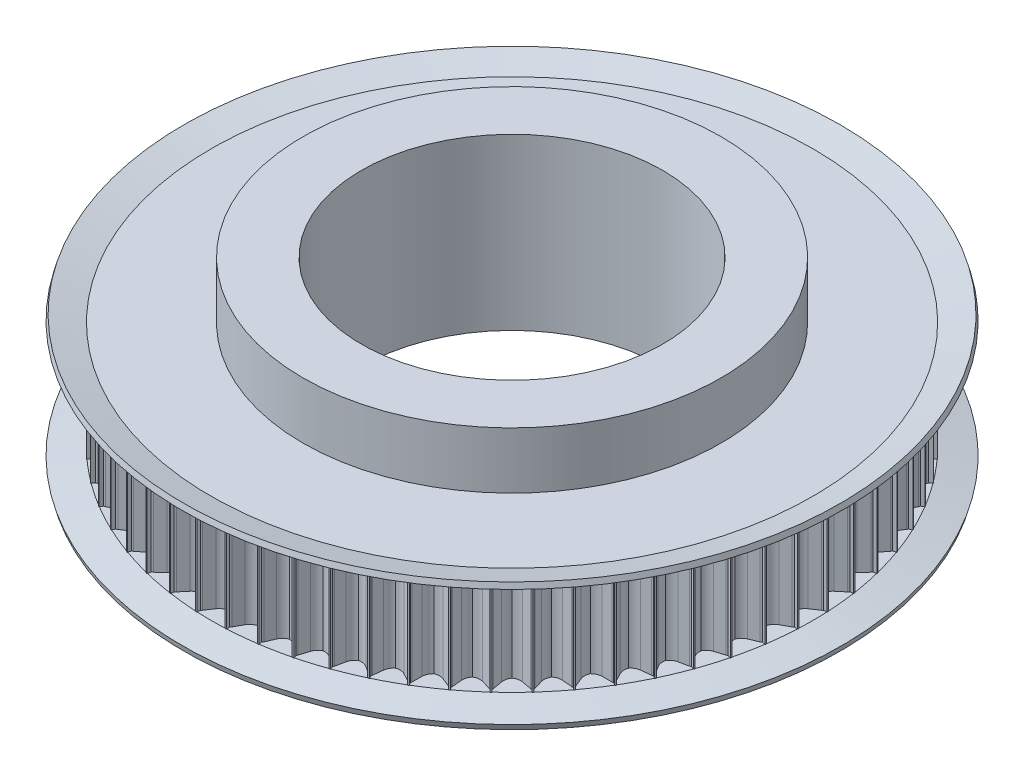
from build123d import *

# Parameters (mm, degrees)
SKETCH1_R           = 80
SKETCH1_R_2         = 40
BOSS_EXTRUDE1_DEPTH = 27
CUT_EXTRUDE2_DEPTH  = 27


with BuildPart() as part:
    # Sketch1 → Boss-Extrude1 (new body)
    with BuildSketch(Plane(origin=(0, 0, 0), x_dir=(1, 0, 0), z_dir=(0, 1, 0))):
        Circle(SKETCH1_R)
        Circle(SKETCH1_R_2, mode=Mode.SUBTRACT)
    extrude(amount=BOSS_EXTRUDE1_DEPTH)

    # Sketch2 → Cut-Extrude2 (cut)
    with BuildSketch(Plane(origin=(0, 27, 0), x_dir=(1, 0, 0), z_dir=(0, 1, 0))):
        with BuildLine():
            Line((76.55820386, 2.007597536), (78.68913052, 3.465599987))
            ThreePointArc((78.68913052, 3.465599987), (78.854600633, 3.596830616), (79, 3.75))
            Line((79, 3.75), (81.356619288, 3.75))
            Line((81.356619288, 3.75), (81.356619288, -3.75))
            Line((81.356619288, -3.75), (79, -3.75))
            ThreePointArc((79, -3.75), (78.854600633, -3.596830616), (78.68913052, -3.465599987))
            Line((78.68913052, -3.465599987), (76.55820386, -2.007597536))
            ThreePointArc((76.55820386, -2.007597536), (75.716480212, -1.134748785), (75.289035669, 0))
            ThreePointArc((75.289035669, 0), (75.716480212, 1.134748785), (76.55820386, 2.007597536))
        make_face()
        with BuildLine():
            Line((76.386334153, -5.506085806), (78.649909049, -4.263971372))
            ThreePointArc((78.649909049, -4.263971372), (78.827445229, -4.149591563), (78.987157683, -4.011411361))
            Line((78.987157683, -4.011411361), (81.332429205, -4.242400444))
            Line((81.332429205, -4.242400444), (80.597300653, -11.706285895))
            Line((80.597300653, -11.706285895), (78.252029131, -11.475296811))
            ThreePointArc((78.252029131, -11.475296811), (78.122343127, -11.308613349), (77.970532648, -11.161795725))
            Line((77.970532648, -11.161795725), (75.992776214, -9.501946616))
            ThreePointArc((75.992776214, -9.501946616), (75.240659834, -8.550797526), (74.926498384, -7.379615974))
            ThreePointArc((74.926498384, -7.379615974), (75.463109496, -6.292228207), (76.386334153, -5.506085806))
        make_face()
        with BuildLine():
            Line((75.47882229, -12.966742532), (77.853245959, -11.952478357))
            ThreePointArc((77.853245959, -11.952478357), (78.041138436, -11.856050906), (78.213625859, -11.734190638))
            Line((78.213625859, -11.734190638), (80.524963369, -12.193944254))
            Line((80.524963369, -12.193944254), (79.061785953, -19.549833857))
            Line((79.061785953, -19.549833857), (76.750448444, -19.090080241))
            ThreePointArc((76.750448444, -19.090080241), (76.63772475, -18.911487954), (76.501035924, -18.750497268))
            Line((76.501035924, -18.750497268), (74.695496591, -16.904786756))
            ThreePointArc((74.695496591, -16.904786756), (74.04023077, -15.884497412), (73.84237796, -14.688162213))
            ThreePointArc((73.84237796, -14.688162213), (74.482987782, -13.658607601), (75.47882229, -12.966742532))
        make_face()
        with BuildLine():
            Line((73.844408108, -20.302522439), (76.306813552, -19.525876441))
            ThreePointArc((76.306813552, -19.525876441), (76.503252818, -19.448329998), (76.686854063, -19.343963244))
            Line((76.686854063, -19.343963244), (78.941998115, -20.028053714))
            Line((78.941998115, -20.028053714), (76.764863036, -27.205106232))
            Line((76.764863036, -27.205106232), (74.509718983, -26.521015762))
            ThreePointArc((74.509718983, -26.521015762), (74.41504319, -26.332234592), (74.294792404, -26.158621272))
            Line((74.294792404, -26.158621272), (72.678858502, -24.144824559))
            ThreePointArc((72.678858502, -24.144824559), (72.12675381, -23.065220904), (72.04711507, -21.85525342))
            ThreePointArc((72.04711507, -21.85525342), (72.78555418, -20.893447138), (73.844408108, -20.302522439))
        make_face()
        with BuildLine():
            Line((71.498831908, -27.442777956), (74.025504817, -26.911229661))
            ThreePointArc((74.025504817, -26.911229661), (74.228599055, -26.853311041), (74.42154594, -26.76744291))
            Line((74.42154594, -26.76744291), (76.598778266, -27.669282068))
            Line((76.598778266, -27.669282068), (73.728652523, -34.598378562))
            Line((73.728652523, -34.598378562), (71.551420197, -33.696539404))
            ThreePointArc((71.551420197, -33.696539404), (71.475704084, -33.499387416), (71.37304942, -33.314823453))
            Line((71.37304942, -33.314823453), (69.962283276, -31.152334502))
            ThreePointArc((69.962283276, -31.152334502), (69.518656782, -30.023813711), (69.557999078, -28.811866589))
            ThreePointArc((69.557999078, -28.811866589), (70.387155902, -27.927071357), (71.498831908, -27.442777956))
        make_face()
        with BuildLine():
            Line((68.464682872, -34.31874452), (71.031290004, -34.037413028))
            ThreePointArc((71.031290004, -34.037413028), (71.239083305, -33.999680018), (71.439517647, -33.933137468))
            Line((71.439517647, -33.933137468), (73.517870309, -35.04404011))
            Line((73.517870309, -35.04404011), (69.982394782, -41.658449593))
            Line((69.982394782, -41.658449593), (67.90404212, -40.547546951))
            ThreePointArc((67.90404212, -40.547546951), (67.848014875, -40.343922826), (67.763944953, -40.150185673))
            Line((67.763944953, -40.150185673), (66.571933017, -37.859830434))
            ThreePointArc((66.571933017, -37.859830434), (66.241057087, -36.693260779), (66.399001529, -35.491005733))
            ThreePointArc((66.399001529, -35.491005733), (67.310890835, -34.691742613), (68.464682872, -34.31874452))
        make_face()
        with BuildLine():
            Line((64.771181513, -40.864202813), (67.353005038, -40.835797501))
            ThreePointArc((67.353005038, -40.835797501), (67.56349624, -40.818613491), (67.769487746, -40.772037362))
            Line((67.769487746, -40.772037362), (69.728945071, -42.081304889))
            Line((69.728945071, -42.081304889), (65.562168324, -48.317326982))
            Line((65.562168324, -48.317326982), (63.602710998, -47.008059455))
            ThreePointArc((63.602710998, -47.008059455), (63.566912194, -46.799924206), (63.502236653, -46.598879657))
            Line((63.502236653, -46.598879657), (62.540458651, -44.202715503))
            ThreePointArc((62.540458651, -44.202715503), (62.3255198, -43.009331687), (62.600545299, -41.828347091))
            ThreePointArc((62.600545299, -41.828347091), (63.586385094, -41.122313423), (64.771181513, -40.864202813))
        make_face()
        with BuildLine():
            Line((60.453898269, -47.016116495), (63.026073816, -47.240910921))
            ThreePointArc((63.026073816, -47.240910921), (63.237235772, -47.244441402), (63.446800631, -47.218280249))
            Line((63.446800631, -47.218280249), (65.268491975, -48.713303698))
            Line((65.268491975, -48.713303698), (60.510542344, -54.510882099))
            Line((60.510542344, -54.510882099), (58.688851, -53.015858649))
            ThreePointArc((58.688851, -53.015858649), (58.673625399, -52.805216732), (58.6289671, -52.598800956))
            Line((58.6289671, -52.598800956), (57.906685481, -50.119904258))
            ThreePointArc((57.906685481, -50.119904258), (57.809753688, -48.91119922), (58.199211596, -47.7628586))
            ThreePointArc((58.199211596, -47.7628586), (59.249507704, -47.156853875), (60.453898269, -47.016116495))
        make_face()
        with BuildLine():
            Line((55.554410937, -52.715239273), (58.092167048, -53.191068544))
            ThreePointArc((58.092167048, -53.191068544), (58.301966155, -53.215279517), (58.513086143, -53.209785284))
            Line((58.513086143, -53.209785284), (60.179467622, -54.876166763))
            Line((60.179467622, -54.876166763), (54.876166763, -60.179467622))
            Line((54.876166763, -60.179467622), (53.209785284, -58.513086143))
            ThreePointArc((53.209785284, -58.513086143), (53.215279517, -58.301966155), (53.191068544, -58.092167048))
            Line((53.191068544, -58.092167048), (52.715239273, -55.554410937))
            ThreePointArc((52.715239273, -55.554410937), (52.737248045, -54.342025167), (53.237387671, -53.237387671))
            ThreePointArc((53.237387671, -53.237387671), (54.342025167, -52.737248045), (55.554410937, -52.715239273))
        make_face()
        with BuildLine():
            Line((50.119904258, -57.906685481), (52.598800956, -58.6289671))
            ThreePointArc((52.598800956, -58.6289671), (52.805216732, -58.673625399), (53.015858649, -58.688851))
            Line((53.015858649, -58.688851), (54.510882099, -60.510542344))
            Line((54.510882099, -60.510542344), (48.713303698, -65.268491975))
            Line((48.713303698, -65.268491975), (47.218280249, -63.446800631))
            ThreePointArc((47.218280249, -63.446800631), (47.244441402, -63.237235772), (47.240910921, -63.026073816))
            Line((47.240910921, -63.026073816), (47.016116495, -60.453898269))
            ThreePointArc((47.016116495, -60.453898269), (47.156853875, -59.249507704), (47.7628586, -58.199211596))
            ThreePointArc((47.7628586, -58.199211596), (48.91119922, -57.809753688), (50.119904258, -57.906685481))
        make_face()
        with BuildLine():
            Line((44.202715503, -62.540458651), (46.598879657, -63.502236653))
            ThreePointArc((46.598879657, -63.502236653), (46.799924206, -63.566912194), (47.008059455, -63.602710998))
            Line((47.008059455, -63.602710998), (48.317326982, -65.562168324))
            Line((48.317326982, -65.562168324), (42.081304889, -69.728945071))
            Line((42.081304889, -69.728945071), (40.772037362, -67.769487746))
            ThreePointArc((40.772037362, -67.769487746), (40.818613491, -67.56349624), (40.835797501, -67.353005038))
            Line((40.835797501, -67.353005038), (40.864202813, -64.771181513))
            ThreePointArc((40.864202813, -64.771181513), (41.122313423, -63.586385094), (41.828347091, -62.600545299))
            ThreePointArc((41.828347091, -62.600545299), (43.009331687, -62.3255198), (44.202715503, -62.540458651))
        make_face()
        with BuildLine():
            Line((37.859830434, -66.571933017), (40.150185673, -67.763944953))
            ThreePointArc((40.150185673, -67.763944953), (40.343922826, -67.848014875), (40.547546951, -67.90404212))
            Line((40.547546951, -67.90404212), (41.658449593, -69.982394782))
            Line((41.658449593, -69.982394782), (35.04404011, -73.517870309))
            Line((35.04404011, -73.517870309), (33.933137468, -71.439517647))
            ThreePointArc((33.933137468, -71.439517647), (33.999680018, -71.239083305), (34.037413028, -71.031290004))
            Line((34.037413028, -71.031290004), (34.31874452, -68.464682872))
            ThreePointArc((34.31874452, -68.464682872), (34.691742613, -67.310890835), (35.491005733, -66.399001529))
            ThreePointArc((35.491005733, -66.399001529), (36.693260779, -66.241057087), (37.859830434, -66.571933017))
        make_face()
        with BuildLine():
            Line((31.152334502, -69.962283276), (33.314823453, -71.37304942))
            ThreePointArc((33.314823453, -71.37304942), (33.499387416, -71.475704084), (33.696539404, -71.551420197))
            Line((33.696539404, -71.551420197), (34.598378562, -73.728652523))
            Line((34.598378562, -73.728652523), (27.669282068, -76.598778266))
            Line((27.669282068, -76.598778266), (26.76744291, -74.42154594))
            ThreePointArc((26.76744291, -74.42154594), (26.853311041, -74.228599055), (26.911229661, -74.025504817))
            Line((26.911229661, -74.025504817), (27.442777956, -71.498831908))
            ThreePointArc((27.442777956, -71.498831908), (27.927071357, -70.387155902), (28.811866589, -69.557999078))
            ThreePointArc((28.811866589, -69.557999078), (30.023813711, -69.518656782), (31.152334502, -69.962283276))
        make_face()
        with BuildLine():
            Line((24.144824559, -72.678858502), (26.158621272, -74.294792404))
            ThreePointArc((26.158621272, -74.294792404), (26.332234592, -74.41504319), (26.521015762, -74.509718983))
            Line((26.521015762, -74.509718983), (27.205106232, -76.764863036))
            Line((27.205106232, -76.764863036), (20.028053714, -78.941998115))
            Line((20.028053714, -78.941998115), (19.343963244, -76.686854063))
            ThreePointArc((19.343963244, -76.686854063), (19.448329998, -76.503252818), (19.525876441, -76.306813552))
            Line((19.525876441, -76.306813552), (20.302522439, -73.844408108))
            ThreePointArc((20.302522439, -73.844408108), (20.893447138, -72.78555418), (21.85525342, -72.04711507))
            ThreePointArc((21.85525342, -72.04711507), (23.065220904, -72.12675381), (24.144824559, -72.678858502))
        make_face()
        with BuildLine():
            Line((16.904786756, -74.695496591), (18.750497268, -76.501035924))
            ThreePointArc((18.750497268, -76.501035924), (18.911487954, -76.63772475), (19.090080241, -76.750448444))
            Line((19.090080241, -76.750448444), (19.549833857, -79.061785953))
            Line((19.549833857, -79.061785953), (12.193944254, -80.524963369))
            Line((12.193944254, -80.524963369), (11.734190638, -78.213625859))
            ThreePointArc((11.734190638, -78.213625859), (11.856050906, -78.041138436), (11.952478357, -77.853245959))
            Line((11.952478357, -77.853245959), (12.966742532, -75.47882229))
            ThreePointArc((12.966742532, -75.47882229), (13.658607601, -74.482987782), (14.688162213, -73.84237796))
            ThreePointArc((14.688162213, -73.84237796), (15.884497412, -74.04023077), (16.904786756, -74.695496591))
        make_face()
        with BuildLine():
            Line((9.501946616, -75.992776214), (11.161795725, -77.970532648))
            ThreePointArc((11.161795725, -77.970532648), (11.308613349, -78.122343127), (11.475296811, -78.252029131))
            Line((11.475296811, -78.252029131), (11.706285895, -80.597300653))
            Line((11.706285895, -80.597300653), (4.242400444, -81.332429205))
            Line((4.242400444, -81.332429205), (4.011411361, -78.987157683))
            ThreePointArc((4.011411361, -78.987157683), (4.149591563, -78.827445229), (4.263971372, -78.649909049))
            Line((4.263971372, -78.649909049), (5.506085806, -76.386334153))
            ThreePointArc((5.506085806, -76.386334153), (6.292228207, -75.463109496), (7.379615974, -74.926498384))
            ThreePointArc((7.379615974, -74.926498384), (8.550797526, -75.240659834), (9.501946616, -75.992776214))
        make_face()
        with BuildLine():
            Line((2.007597536, -76.55820386), (3.465599987, -78.68913052))
            ThreePointArc((3.465599987, -78.68913052), (3.596830616, -78.854600633), (3.75, -79))
            Line((3.75, -79), (3.75, -81.356619288))
            Line((3.75, -81.356619288), (-3.75, -81.356619288))
            Line((-3.75, -81.356619288), (-3.75, -79))
            ThreePointArc((-3.75, -79), (-3.596830616, -78.854600633), (-3.465599987, -78.68913052))
            Line((-3.465599987, -78.68913052), (-2.007597536, -76.55820386))
            ThreePointArc((-2.007597536, -76.55820386), (-1.134748785, -75.716480212), (0, -75.289035669))
            ThreePointArc((0, -75.289035669), (1.134748785, -75.716480212), (2.007597536, -76.55820386))
        make_face()
        with BuildLine():
            Line((-5.506085806, -76.386334153), (-4.263971372, -78.649909049))
            ThreePointArc((-4.263971372, -78.649909049), (-4.149591563, -78.827445229), (-4.011411361, -78.987157683))
            Line((-4.011411361, -78.987157683), (-4.242400444, -81.332429205))
            Line((-4.242400444, -81.332429205), (-11.706285895, -80.597300653))
            Line((-11.706285895, -80.597300653), (-11.475296811, -78.252029131))
            ThreePointArc((-11.475296811, -78.252029131), (-11.308613349, -78.122343127), (-11.161795725, -77.970532648))
            Line((-11.161795725, -77.970532648), (-9.501946616, -75.992776214))
            ThreePointArc((-9.501946616, -75.992776214), (-8.550797526, -75.240659834), (-7.379615974, -74.926498384))
            ThreePointArc((-7.379615974, -74.926498384), (-6.292228207, -75.463109496), (-5.506085806, -76.386334153))
        make_face()
        with BuildLine():
            Line((-12.966742532, -75.47882229), (-11.952478357, -77.853245959))
            ThreePointArc((-11.952478357, -77.853245959), (-11.856050906, -78.041138436), (-11.734190638, -78.213625859))
            Line((-11.734190638, -78.213625859), (-12.193944254, -80.524963369))
            Line((-12.193944254, -80.524963369), (-19.549833857, -79.061785953))
            Line((-19.549833857, -79.061785953), (-19.090080241, -76.750448444))
            ThreePointArc((-19.090080241, -76.750448444), (-18.911487954, -76.63772475), (-18.750497268, -76.501035924))
            Line((-18.750497268, -76.501035924), (-16.904786756, -74.695496591))
            ThreePointArc((-16.904786756, -74.695496591), (-15.884497412, -74.04023077), (-14.688162213, -73.84237796))
            ThreePointArc((-14.688162213, -73.84237796), (-13.658607601, -74.482987782), (-12.966742532, -75.47882229))
        make_face()
        with BuildLine():
            Line((-20.302522439, -73.844408108), (-19.525876441, -76.306813552))
            ThreePointArc((-19.525876441, -76.306813552), (-19.448329998, -76.503252818), (-19.343963244, -76.686854063))
            Line((-19.343963244, -76.686854063), (-20.028053714, -78.941998115))
            Line((-20.028053714, -78.941998115), (-27.205106232, -76.764863036))
            Line((-27.205106232, -76.764863036), (-26.521015762, -74.509718983))
            ThreePointArc((-26.521015762, -74.509718983), (-26.332234592, -74.41504319), (-26.158621272, -74.294792404))
            Line((-26.158621272, -74.294792404), (-24.144824559, -72.678858502))
            ThreePointArc((-24.144824559, -72.678858502), (-23.065220904, -72.12675381), (-21.85525342, -72.04711507))
            ThreePointArc((-21.85525342, -72.04711507), (-20.893447138, -72.78555418), (-20.302522439, -73.844408108))
        make_face()
        with BuildLine():
            Line((-27.442777956, -71.498831908), (-26.911229661, -74.025504817))
            ThreePointArc((-26.911229661, -74.025504817), (-26.853311041, -74.228599055), (-26.76744291, -74.42154594))
            Line((-26.76744291, -74.42154594), (-27.669282068, -76.598778266))
            Line((-27.669282068, -76.598778266), (-34.598378562, -73.728652523))
            Line((-34.598378562, -73.728652523), (-33.696539404, -71.551420197))
            ThreePointArc((-33.696539404, -71.551420197), (-33.499387416, -71.475704084), (-33.314823453, -71.37304942))
            Line((-33.314823453, -71.37304942), (-31.152334502, -69.962283276))
            ThreePointArc((-31.152334502, -69.962283276), (-30.023813711, -69.518656782), (-28.811866589, -69.557999078))
            ThreePointArc((-28.811866589, -69.557999078), (-27.927071357, -70.387155902), (-27.442777956, -71.498831908))
        make_face()
        with BuildLine():
            Line((-34.31874452, -68.464682872), (-34.037413028, -71.031290004))
            ThreePointArc((-34.037413028, -71.031290004), (-33.999680018, -71.239083305), (-33.933137468, -71.439517647))
            Line((-33.933137468, -71.439517647), (-35.04404011, -73.517870309))
            Line((-35.04404011, -73.517870309), (-41.658449593, -69.982394782))
            Line((-41.658449593, -69.982394782), (-40.547546951, -67.90404212))
            ThreePointArc((-40.547546951, -67.90404212), (-40.343922826, -67.848014875), (-40.150185673, -67.763944953))
            Line((-40.150185673, -67.763944953), (-37.859830434, -66.571933017))
            ThreePointArc((-37.859830434, -66.571933017), (-36.693260779, -66.241057087), (-35.491005733, -66.399001529))
            ThreePointArc((-35.491005733, -66.399001529), (-34.691742613, -67.310890835), (-34.31874452, -68.464682872))
        make_face()
        with BuildLine():
            Line((-40.864202813, -64.771181513), (-40.835797501, -67.353005038))
            ThreePointArc((-40.835797501, -67.353005038), (-40.818613491, -67.56349624), (-40.772037362, -67.769487746))
            Line((-40.772037362, -67.769487746), (-42.081304889, -69.728945071))
            Line((-42.081304889, -69.728945071), (-48.317326982, -65.562168324))
            Line((-48.317326982, -65.562168324), (-47.008059455, -63.602710998))
            ThreePointArc((-47.008059455, -63.602710998), (-46.799924206, -63.566912194), (-46.598879657, -63.502236653))
            Line((-46.598879657, -63.502236653), (-44.202715503, -62.540458651))
            ThreePointArc((-44.202715503, -62.540458651), (-43.009331687, -62.3255198), (-41.828347091, -62.600545299))
            ThreePointArc((-41.828347091, -62.600545299), (-41.122313423, -63.586385094), (-40.864202813, -64.771181513))
        make_face()
        with BuildLine():
            Line((-47.016116495, -60.453898269), (-47.240910921, -63.026073816))
            ThreePointArc((-47.240910921, -63.026073816), (-47.244441402, -63.237235772), (-47.218280249, -63.446800631))
            Line((-47.218280249, -63.446800631), (-48.713303698, -65.268491975))
            Line((-48.713303698, -65.268491975), (-54.510882099, -60.510542344))
            Line((-54.510882099, -60.510542344), (-53.015858649, -58.688851))
            ThreePointArc((-53.015858649, -58.688851), (-52.805216732, -58.673625399), (-52.598800956, -58.6289671))
            Line((-52.598800956, -58.6289671), (-50.119904258, -57.906685481))
            ThreePointArc((-50.119904258, -57.906685481), (-48.91119922, -57.809753688), (-47.7628586, -58.199211596))
            ThreePointArc((-47.7628586, -58.199211596), (-47.156853875, -59.249507704), (-47.016116495, -60.453898269))
        make_face()
        with BuildLine():
            Line((-52.715239273, -55.554410937), (-53.191068544, -58.092167048))
            ThreePointArc((-53.191068544, -58.092167048), (-53.215279517, -58.301966155), (-53.209785284, -58.513086143))
            Line((-53.209785284, -58.513086143), (-54.876166763, -60.179467622))
            Line((-54.876166763, -60.179467622), (-60.179467622, -54.876166763))
            Line((-60.179467622, -54.876166763), (-58.513086143, -53.209785284))
            ThreePointArc((-58.513086143, -53.209785284), (-58.301966155, -53.215279517), (-58.092167048, -53.191068544))
            Line((-58.092167048, -53.191068544), (-55.554410937, -52.715239273))
            ThreePointArc((-55.554410937, -52.715239273), (-54.342025167, -52.737248045), (-53.237387671, -53.237387671))
            ThreePointArc((-53.237387671, -53.237387671), (-52.737248045, -54.342025167), (-52.715239273, -55.554410937))
        make_face()
        with BuildLine():
            Line((-57.906685481, -50.119904258), (-58.6289671, -52.598800956))
            ThreePointArc((-58.6289671, -52.598800956), (-58.673625399, -52.805216732), (-58.688851, -53.015858649))
            Line((-58.688851, -53.015858649), (-60.510542344, -54.510882099))
            Line((-60.510542344, -54.510882099), (-65.268491975, -48.713303698))
            Line((-65.268491975, -48.713303698), (-63.446800631, -47.218280249))
            ThreePointArc((-63.446800631, -47.218280249), (-63.237235772, -47.244441402), (-63.026073816, -47.240910921))
            Line((-63.026073816, -47.240910921), (-60.453898269, -47.016116495))
            ThreePointArc((-60.453898269, -47.016116495), (-59.249507704, -47.156853875), (-58.199211596, -47.7628586))
            ThreePointArc((-58.199211596, -47.7628586), (-57.809753688, -48.91119922), (-57.906685481, -50.119904258))
        make_face()
        with BuildLine():
            Line((-62.540458651, -44.202715503), (-63.502236653, -46.598879657))
            ThreePointArc((-63.502236653, -46.598879657), (-63.566912194, -46.799924206), (-63.602710998, -47.008059455))
            Line((-63.602710998, -47.008059455), (-65.562168324, -48.317326982))
            Line((-65.562168324, -48.317326982), (-69.728945071, -42.081304889))
            Line((-69.728945071, -42.081304889), (-67.769487746, -40.772037362))
            ThreePointArc((-67.769487746, -40.772037362), (-67.56349624, -40.818613491), (-67.353005038, -40.835797501))
            Line((-67.353005038, -40.835797501), (-64.771181513, -40.864202813))
            ThreePointArc((-64.771181513, -40.864202813), (-63.586385094, -41.122313423), (-62.600545299, -41.828347091))
            ThreePointArc((-62.600545299, -41.828347091), (-62.3255198, -43.009331687), (-62.540458651, -44.202715503))
        make_face()
        with BuildLine():
            Line((-66.571933017, -37.859830434), (-67.763944953, -40.150185673))
            ThreePointArc((-67.763944953, -40.150185673), (-67.848014875, -40.343922826), (-67.90404212, -40.547546951))
            Line((-67.90404212, -40.547546951), (-69.982394782, -41.658449593))
            Line((-69.982394782, -41.658449593), (-73.517870309, -35.04404011))
            Line((-73.517870309, -35.04404011), (-71.439517647, -33.933137468))
            ThreePointArc((-71.439517647, -33.933137468), (-71.239083305, -33.999680018), (-71.031290004, -34.037413028))
            Line((-71.031290004, -34.037413028), (-68.464682872, -34.31874452))
            ThreePointArc((-68.464682872, -34.31874452), (-67.310890835, -34.691742613), (-66.399001529, -35.491005733))
            ThreePointArc((-66.399001529, -35.491005733), (-66.241057087, -36.693260779), (-66.571933017, -37.859830434))
        make_face()
        with BuildLine():
            Line((-69.962283276, -31.152334502), (-71.37304942, -33.314823453))
            ThreePointArc((-71.37304942, -33.314823453), (-71.475704084, -33.499387416), (-71.551420197, -33.696539404))
            Line((-71.551420197, -33.696539404), (-73.728652523, -34.598378562))
            Line((-73.728652523, -34.598378562), (-76.598778266, -27.669282068))
            Line((-76.598778266, -27.669282068), (-74.42154594, -26.76744291))
            ThreePointArc((-74.42154594, -26.76744291), (-74.228599055, -26.853311041), (-74.025504817, -26.911229661))
            Line((-74.025504817, -26.911229661), (-71.498831908, -27.442777956))
            ThreePointArc((-71.498831908, -27.442777956), (-70.387155902, -27.927071357), (-69.557999078, -28.811866589))
            ThreePointArc((-69.557999078, -28.811866589), (-69.518656782, -30.023813711), (-69.962283276, -31.152334502))
        make_face()
        with BuildLine():
            Line((-72.678858502, -24.144824559), (-74.294792404, -26.158621272))
            ThreePointArc((-74.294792404, -26.158621272), (-74.41504319, -26.332234592), (-74.509718983, -26.521015762))
            Line((-74.509718983, -26.521015762), (-76.764863036, -27.205106232))
            Line((-76.764863036, -27.205106232), (-78.941998115, -20.028053714))
            Line((-78.941998115, -20.028053714), (-76.686854063, -19.343963244))
            ThreePointArc((-76.686854063, -19.343963244), (-76.503252818, -19.448329998), (-76.306813552, -19.525876441))
            Line((-76.306813552, -19.525876441), (-73.844408108, -20.302522439))
            ThreePointArc((-73.844408108, -20.302522439), (-72.78555418, -20.893447138), (-72.04711507, -21.85525342))
            ThreePointArc((-72.04711507, -21.85525342), (-72.12675381, -23.065220904), (-72.678858502, -24.144824559))
        make_face()
        with BuildLine():
            Line((-74.695496591, -16.904786756), (-76.501035924, -18.750497268))
            ThreePointArc((-76.501035924, -18.750497268), (-76.63772475, -18.911487954), (-76.750448444, -19.090080241))
            Line((-76.750448444, -19.090080241), (-79.061785953, -19.549833857))
            Line((-79.061785953, -19.549833857), (-80.524963369, -12.193944254))
            Line((-80.524963369, -12.193944254), (-78.213625859, -11.734190638))
            ThreePointArc((-78.213625859, -11.734190638), (-78.041138436, -11.856050906), (-77.853245959, -11.952478357))
            Line((-77.853245959, -11.952478357), (-75.47882229, -12.966742532))
            ThreePointArc((-75.47882229, -12.966742532), (-74.482987782, -13.658607601), (-73.84237796, -14.688162213))
            ThreePointArc((-73.84237796, -14.688162213), (-74.04023077, -15.884497412), (-74.695496591, -16.904786756))
        make_face()
        with BuildLine():
            Line((-75.992776214, -9.501946616), (-77.970532648, -11.161795725))
            ThreePointArc((-77.970532648, -11.161795725), (-78.122343127, -11.308613349), (-78.252029131, -11.475296811))
            Line((-78.252029131, -11.475296811), (-80.597300653, -11.706285895))
            Line((-80.597300653, -11.706285895), (-81.332429205, -4.242400444))
            Line((-81.332429205, -4.242400444), (-78.987157683, -4.011411361))
            ThreePointArc((-78.987157683, -4.011411361), (-78.827445229, -4.149591563), (-78.649909049, -4.263971372))
            Line((-78.649909049, -4.263971372), (-76.386334153, -5.506085806))
            ThreePointArc((-76.386334153, -5.506085806), (-75.463109496, -6.292228207), (-74.926498384, -7.379615974))
            ThreePointArc((-74.926498384, -7.379615974), (-75.240659834, -8.550797526), (-75.992776214, -9.501946616))
        make_face()
        with BuildLine():
            Line((-76.55820386, -2.007597536), (-78.68913052, -3.465599987))
            ThreePointArc((-78.68913052, -3.465599987), (-78.854600633, -3.596830616), (-79, -3.75))
            Line((-79, -3.75), (-81.356619288, -3.75))
            Line((-81.356619288, -3.75), (-81.356619288, 3.75))
            Line((-81.356619288, 3.75), (-79, 3.75))
            ThreePointArc((-79, 3.75), (-78.854600633, 3.596830616), (-78.68913052, 3.465599987))
            Line((-78.68913052, 3.465599987), (-76.55820386, 2.007597536))
            ThreePointArc((-76.55820386, 2.007597536), (-75.716480212, 1.134748785), (-75.289035669, 0))
            ThreePointArc((-75.289035669, 0), (-75.716480212, -1.134748785), (-76.55820386, -2.007597536))
        make_face()
        with BuildLine():
            Line((-76.386334153, 5.506085806), (-78.649909049, 4.263971372))
            ThreePointArc((-78.649909049, 4.263971372), (-78.827445229, 4.149591563), (-78.987157683, 4.011411361))
            Line((-78.987157683, 4.011411361), (-81.332429205, 4.242400444))
            Line((-81.332429205, 4.242400444), (-80.597300653, 11.706285895))
            Line((-80.597300653, 11.706285895), (-78.252029131, 11.475296811))
            ThreePointArc((-78.252029131, 11.475296811), (-78.122343127, 11.308613349), (-77.970532648, 11.161795725))
            Line((-77.970532648, 11.161795725), (-75.992776214, 9.501946616))
            ThreePointArc((-75.992776214, 9.501946616), (-75.240659834, 8.550797526), (-74.926498384, 7.379615974))
            ThreePointArc((-74.926498384, 7.379615974), (-75.463109496, 6.292228207), (-76.386334153, 5.506085806))
        make_face()
        with BuildLine():
            Line((-75.47882229, 12.966742532), (-77.853245959, 11.952478357))
            ThreePointArc((-77.853245959, 11.952478357), (-78.041138436, 11.856050906), (-78.213625859, 11.734190638))
            Line((-78.213625859, 11.734190638), (-80.524963369, 12.193944254))
            Line((-80.524963369, 12.193944254), (-79.061785953, 19.549833857))
            Line((-79.061785953, 19.549833857), (-76.750448444, 19.090080241))
            ThreePointArc((-76.750448444, 19.090080241), (-76.63772475, 18.911487954), (-76.501035924, 18.750497268))
            Line((-76.501035924, 18.750497268), (-74.695496591, 16.904786756))
            ThreePointArc((-74.695496591, 16.904786756), (-74.04023077, 15.884497412), (-73.84237796, 14.688162213))
            ThreePointArc((-73.84237796, 14.688162213), (-74.482987782, 13.658607601), (-75.47882229, 12.966742532))
        make_face()
        with BuildLine():
            Line((-73.844408108, 20.302522439), (-76.306813552, 19.525876441))
            ThreePointArc((-76.306813552, 19.525876441), (-76.503252818, 19.448329998), (-76.686854063, 19.343963244))
            Line((-76.686854063, 19.343963244), (-78.941998115, 20.028053714))
            Line((-78.941998115, 20.028053714), (-76.764863036, 27.205106232))
            Line((-76.764863036, 27.205106232), (-74.509718983, 26.521015762))
            ThreePointArc((-74.509718983, 26.521015762), (-74.41504319, 26.332234592), (-74.294792404, 26.158621272))
            Line((-74.294792404, 26.158621272), (-72.678858502, 24.144824559))
            ThreePointArc((-72.678858502, 24.144824559), (-72.12675381, 23.065220904), (-72.04711507, 21.85525342))
            ThreePointArc((-72.04711507, 21.85525342), (-72.78555418, 20.893447138), (-73.844408108, 20.302522439))
        make_face()
        with BuildLine():
            Line((-71.498831908, 27.442777956), (-74.025504817, 26.911229661))
            ThreePointArc((-74.025504817, 26.911229661), (-74.228599055, 26.853311041), (-74.42154594, 26.76744291))
            Line((-74.42154594, 26.76744291), (-76.598778266, 27.669282068))
            Line((-76.598778266, 27.669282068), (-73.728652523, 34.598378562))
            Line((-73.728652523, 34.598378562), (-71.551420197, 33.696539404))
            ThreePointArc((-71.551420197, 33.696539404), (-71.475704084, 33.499387416), (-71.37304942, 33.314823453))
            Line((-71.37304942, 33.314823453), (-69.962283276, 31.152334502))
            ThreePointArc((-69.962283276, 31.152334502), (-69.518656782, 30.023813711), (-69.557999078, 28.811866589))
            ThreePointArc((-69.557999078, 28.811866589), (-70.387155902, 27.927071357), (-71.498831908, 27.442777956))
        make_face()
        with BuildLine():
            Line((-68.464682872, 34.31874452), (-71.031290004, 34.037413028))
            ThreePointArc((-71.031290004, 34.037413028), (-71.239083305, 33.999680018), (-71.439517647, 33.933137468))
            Line((-71.439517647, 33.933137468), (-73.517870309, 35.04404011))
            Line((-73.517870309, 35.04404011), (-69.982394782, 41.658449593))
            Line((-69.982394782, 41.658449593), (-67.90404212, 40.547546951))
            ThreePointArc((-67.90404212, 40.547546951), (-67.848014875, 40.343922826), (-67.763944953, 40.150185673))
            Line((-67.763944953, 40.150185673), (-66.571933017, 37.859830434))
            ThreePointArc((-66.571933017, 37.859830434), (-66.241057087, 36.693260779), (-66.399001529, 35.491005733))
            ThreePointArc((-66.399001529, 35.491005733), (-67.310890835, 34.691742613), (-68.464682872, 34.31874452))
        make_face()
        with BuildLine():
            Line((-64.771181513, 40.864202813), (-67.353005038, 40.835797501))
            ThreePointArc((-67.353005038, 40.835797501), (-67.56349624, 40.818613491), (-67.769487746, 40.772037362))
            Line((-67.769487746, 40.772037362), (-69.728945071, 42.081304889))
            Line((-69.728945071, 42.081304889), (-65.562168324, 48.317326982))
            Line((-65.562168324, 48.317326982), (-63.602710998, 47.008059455))
            ThreePointArc((-63.602710998, 47.008059455), (-63.566912194, 46.799924206), (-63.502236653, 46.598879657))
            Line((-63.502236653, 46.598879657), (-62.540458651, 44.202715503))
            ThreePointArc((-62.540458651, 44.202715503), (-62.3255198, 43.009331687), (-62.600545299, 41.828347091))
            ThreePointArc((-62.600545299, 41.828347091), (-63.586385094, 41.122313423), (-64.771181513, 40.864202813))
        make_face()
        with BuildLine():
            Line((-60.453898269, 47.016116495), (-63.026073816, 47.240910921))
            ThreePointArc((-63.026073816, 47.240910921), (-63.237235772, 47.244441402), (-63.446800631, 47.218280249))
            Line((-63.446800631, 47.218280249), (-65.268491975, 48.713303698))
            Line((-65.268491975, 48.713303698), (-60.510542344, 54.510882099))
            Line((-60.510542344, 54.510882099), (-58.688851, 53.015858649))
            ThreePointArc((-58.688851, 53.015858649), (-58.673625399, 52.805216732), (-58.6289671, 52.598800956))
            Line((-58.6289671, 52.598800956), (-57.906685481, 50.119904258))
            ThreePointArc((-57.906685481, 50.119904258), (-57.809753688, 48.91119922), (-58.199211596, 47.7628586))
            ThreePointArc((-58.199211596, 47.7628586), (-59.249507704, 47.156853875), (-60.453898269, 47.016116495))
        make_face()
        with BuildLine():
            Line((-55.554410937, 52.715239273), (-58.092167048, 53.191068544))
            ThreePointArc((-58.092167048, 53.191068544), (-58.301966155, 53.215279517), (-58.513086143, 53.209785284))
            Line((-58.513086143, 53.209785284), (-60.179467622, 54.876166763))
            Line((-60.179467622, 54.876166763), (-54.876166763, 60.179467622))
            Line((-54.876166763, 60.179467622), (-53.209785284, 58.513086143))
            ThreePointArc((-53.209785284, 58.513086143), (-53.215279517, 58.301966155), (-53.191068544, 58.092167048))
            Line((-53.191068544, 58.092167048), (-52.715239273, 55.554410937))
            ThreePointArc((-52.715239273, 55.554410937), (-52.737248045, 54.342025167), (-53.237387671, 53.237387671))
            ThreePointArc((-53.237387671, 53.237387671), (-54.342025167, 52.737248045), (-55.554410937, 52.715239273))
        make_face()
        with BuildLine():
            Line((-50.119904258, 57.906685481), (-52.598800956, 58.6289671))
            ThreePointArc((-52.598800956, 58.6289671), (-52.805216732, 58.673625399), (-53.015858649, 58.688851))
            Line((-53.015858649, 58.688851), (-54.510882099, 60.510542344))
            Line((-54.510882099, 60.510542344), (-48.713303698, 65.268491975))
            Line((-48.713303698, 65.268491975), (-47.218280249, 63.446800631))
            ThreePointArc((-47.218280249, 63.446800631), (-47.244441402, 63.237235772), (-47.240910921, 63.026073816))
            Line((-47.240910921, 63.026073816), (-47.016116495, 60.453898269))
            ThreePointArc((-47.016116495, 60.453898269), (-47.156853875, 59.249507704), (-47.7628586, 58.199211596))
            ThreePointArc((-47.7628586, 58.199211596), (-48.91119922, 57.809753688), (-50.119904258, 57.906685481))
        make_face()
        with BuildLine():
            Line((-44.202715503, 62.540458651), (-46.598879657, 63.502236653))
            ThreePointArc((-46.598879657, 63.502236653), (-46.799924206, 63.566912194), (-47.008059455, 63.602710998))
            Line((-47.008059455, 63.602710998), (-48.317326982, 65.562168324))
            Line((-48.317326982, 65.562168324), (-42.081304889, 69.728945071))
            Line((-42.081304889, 69.728945071), (-40.772037362, 67.769487746))
            ThreePointArc((-40.772037362, 67.769487746), (-40.818613491, 67.56349624), (-40.835797501, 67.353005038))
            Line((-40.835797501, 67.353005038), (-40.864202813, 64.771181513))
            ThreePointArc((-40.864202813, 64.771181513), (-41.122313423, 63.586385094), (-41.828347091, 62.600545299))
            ThreePointArc((-41.828347091, 62.600545299), (-43.009331687, 62.3255198), (-44.202715503, 62.540458651))
        make_face()
        with BuildLine():
            Line((-37.859830434, 66.571933017), (-40.150185673, 67.763944953))
            ThreePointArc((-40.150185673, 67.763944953), (-40.343922826, 67.848014875), (-40.547546951, 67.90404212))
            Line((-40.547546951, 67.90404212), (-41.658449593, 69.982394782))
            Line((-41.658449593, 69.982394782), (-35.04404011, 73.517870309))
            Line((-35.04404011, 73.517870309), (-33.933137468, 71.439517647))
            ThreePointArc((-33.933137468, 71.439517647), (-33.999680018, 71.239083305), (-34.037413028, 71.031290004))
            Line((-34.037413028, 71.031290004), (-34.31874452, 68.464682872))
            ThreePointArc((-34.31874452, 68.464682872), (-34.691742613, 67.310890835), (-35.491005733, 66.399001529))
            ThreePointArc((-35.491005733, 66.399001529), (-36.693260779, 66.241057087), (-37.859830434, 66.571933017))
        make_face()
        with BuildLine():
            Line((-31.152334502, 69.962283276), (-33.314823453, 71.37304942))
            ThreePointArc((-33.314823453, 71.37304942), (-33.499387416, 71.475704084), (-33.696539404, 71.551420197))
            Line((-33.696539404, 71.551420197), (-34.598378562, 73.728652523))
            Line((-34.598378562, 73.728652523), (-27.669282068, 76.598778266))
            Line((-27.669282068, 76.598778266), (-26.76744291, 74.42154594))
            ThreePointArc((-26.76744291, 74.42154594), (-26.853311041, 74.228599055), (-26.911229661, 74.025504817))
            Line((-26.911229661, 74.025504817), (-27.442777956, 71.498831908))
            ThreePointArc((-27.442777956, 71.498831908), (-27.927071357, 70.387155902), (-28.811866589, 69.557999078))
            ThreePointArc((-28.811866589, 69.557999078), (-30.023813711, 69.518656782), (-31.152334502, 69.962283276))
        make_face()
        with BuildLine():
            Line((-24.144824559, 72.678858502), (-26.158621272, 74.294792404))
            ThreePointArc((-26.158621272, 74.294792404), (-26.332234592, 74.41504319), (-26.521015762, 74.509718983))
            Line((-26.521015762, 74.509718983), (-27.205106232, 76.764863036))
            Line((-27.205106232, 76.764863036), (-20.028053714, 78.941998115))
            Line((-20.028053714, 78.941998115), (-19.343963244, 76.686854063))
            ThreePointArc((-19.343963244, 76.686854063), (-19.448329998, 76.503252818), (-19.525876441, 76.306813552))
            Line((-19.525876441, 76.306813552), (-20.302522439, 73.844408108))
            ThreePointArc((-20.302522439, 73.844408108), (-20.893447138, 72.78555418), (-21.85525342, 72.04711507))
            ThreePointArc((-21.85525342, 72.04711507), (-23.065220904, 72.12675381), (-24.144824559, 72.678858502))
        make_face()
        with BuildLine():
            Line((-16.904786756, 74.695496591), (-18.750497268, 76.501035924))
            ThreePointArc((-18.750497268, 76.501035924), (-18.911487954, 76.63772475), (-19.090080241, 76.750448444))
            Line((-19.090080241, 76.750448444), (-19.549833857, 79.061785953))
            Line((-19.549833857, 79.061785953), (-12.193944254, 80.524963369))
            Line((-12.193944254, 80.524963369), (-11.734190638, 78.213625859))
            ThreePointArc((-11.734190638, 78.213625859), (-11.856050906, 78.041138436), (-11.952478357, 77.853245959))
            Line((-11.952478357, 77.853245959), (-12.966742532, 75.47882229))
            ThreePointArc((-12.966742532, 75.47882229), (-13.658607601, 74.482987782), (-14.688162213, 73.84237796))
            ThreePointArc((-14.688162213, 73.84237796), (-15.884497412, 74.04023077), (-16.904786756, 74.695496591))
        make_face()
        with BuildLine():
            Line((-9.501946616, 75.992776214), (-11.161795725, 77.970532648))
            ThreePointArc((-11.161795725, 77.970532648), (-11.308613349, 78.122343127), (-11.475296811, 78.252029131))
            Line((-11.475296811, 78.252029131), (-11.706285895, 80.597300653))
            Line((-11.706285895, 80.597300653), (-4.242400444, 81.332429205))
            Line((-4.242400444, 81.332429205), (-4.011411361, 78.987157683))
            ThreePointArc((-4.011411361, 78.987157683), (-4.149591563, 78.827445229), (-4.263971372, 78.649909049))
            Line((-4.263971372, 78.649909049), (-5.506085806, 76.386334153))
            ThreePointArc((-5.506085806, 76.386334153), (-6.292228207, 75.463109496), (-7.379615974, 74.926498384))
            ThreePointArc((-7.379615974, 74.926498384), (-8.550797526, 75.240659834), (-9.501946616, 75.992776214))
        make_face()
        with BuildLine():
            Line((-2.007597536, 76.55820386), (-3.465599987, 78.68913052))
            ThreePointArc((-3.465599987, 78.68913052), (-3.596830616, 78.854600633), (-3.75, 79))
            Line((-3.75, 79), (-3.75, 81.356619288))
            Line((-3.75, 81.356619288), (3.75, 81.356619288))
            Line((3.75, 81.356619288), (3.75, 79))
            ThreePointArc((3.75, 79), (3.596830616, 78.854600633), (3.465599987, 78.68913052))
            Line((3.465599987, 78.68913052), (2.007597536, 76.55820386))
            ThreePointArc((2.007597536, 76.55820386), (1.134748785, 75.716480212), (0, 75.289035669))
            ThreePointArc((0, 75.289035669), (-1.134748785, 75.716480212), (-2.007597536, 76.55820386))
        make_face()
        with BuildLine():
            Line((5.506085806, 76.386334153), (4.263971372, 78.649909049))
            ThreePointArc((4.263971372, 78.649909049), (4.149591563, 78.827445229), (4.011411361, 78.987157683))
            Line((4.011411361, 78.987157683), (4.242400444, 81.332429205))
            Line((4.242400444, 81.332429205), (11.706285895, 80.597300653))
            Line((11.706285895, 80.597300653), (11.475296811, 78.252029131))
            ThreePointArc((11.475296811, 78.252029131), (11.308613349, 78.122343127), (11.161795725, 77.970532648))
            Line((11.161795725, 77.970532648), (9.501946616, 75.992776214))
            ThreePointArc((9.501946616, 75.992776214), (8.550797526, 75.240659834), (7.379615974, 74.926498384))
            ThreePointArc((7.379615974, 74.926498384), (6.292228207, 75.463109496), (5.506085806, 76.386334153))
        make_face()
        with BuildLine():
            Line((12.966742532, 75.47882229), (11.952478357, 77.853245959))
            ThreePointArc((11.952478357, 77.853245959), (11.856050906, 78.041138436), (11.734190638, 78.213625859))
            Line((11.734190638, 78.213625859), (12.193944254, 80.524963369))
            Line((12.193944254, 80.524963369), (19.549833857, 79.061785953))
            Line((19.549833857, 79.061785953), (19.090080241, 76.750448444))
            ThreePointArc((19.090080241, 76.750448444), (18.911487954, 76.63772475), (18.750497268, 76.501035924))
            Line((18.750497268, 76.501035924), (16.904786756, 74.695496591))
            ThreePointArc((16.904786756, 74.695496591), (15.884497412, 74.04023077), (14.688162213, 73.84237796))
            ThreePointArc((14.688162213, 73.84237796), (13.658607601, 74.482987782), (12.966742532, 75.47882229))
        make_face()
        with BuildLine():
            Line((20.302522439, 73.844408108), (19.525876441, 76.306813552))
            ThreePointArc((19.525876441, 76.306813552), (19.448329998, 76.503252818), (19.343963244, 76.686854063))
            Line((19.343963244, 76.686854063), (20.028053714, 78.941998115))
            Line((20.028053714, 78.941998115), (27.205106232, 76.764863036))
            Line((27.205106232, 76.764863036), (26.521015762, 74.509718983))
            ThreePointArc((26.521015762, 74.509718983), (26.332234592, 74.41504319), (26.158621272, 74.294792404))
            Line((26.158621272, 74.294792404), (24.144824559, 72.678858502))
            ThreePointArc((24.144824559, 72.678858502), (23.065220904, 72.12675381), (21.85525342, 72.04711507))
            ThreePointArc((21.85525342, 72.04711507), (20.893447138, 72.78555418), (20.302522439, 73.844408108))
        make_face()
        with BuildLine():
            Line((27.442777956, 71.498831908), (26.911229661, 74.025504817))
            ThreePointArc((26.911229661, 74.025504817), (26.853311041, 74.228599055), (26.76744291, 74.42154594))
            Line((26.76744291, 74.42154594), (27.669282068, 76.598778266))
            Line((27.669282068, 76.598778266), (34.598378562, 73.728652523))
            Line((34.598378562, 73.728652523), (33.696539404, 71.551420197))
            ThreePointArc((33.696539404, 71.551420197), (33.499387416, 71.475704084), (33.314823453, 71.37304942))
            Line((33.314823453, 71.37304942), (31.152334502, 69.962283276))
            ThreePointArc((31.152334502, 69.962283276), (30.023813711, 69.518656782), (28.811866589, 69.557999078))
            ThreePointArc((28.811866589, 69.557999078), (27.927071357, 70.387155902), (27.442777956, 71.498831908))
        make_face()
        with BuildLine():
            Line((34.31874452, 68.464682872), (34.037413028, 71.031290004))
            ThreePointArc((34.037413028, 71.031290004), (33.999680018, 71.239083305), (33.933137468, 71.439517647))
            Line((33.933137468, 71.439517647), (35.04404011, 73.517870309))
            Line((35.04404011, 73.517870309), (41.658449593, 69.982394782))
            Line((41.658449593, 69.982394782), (40.547546951, 67.90404212))
            ThreePointArc((40.547546951, 67.90404212), (40.343922826, 67.848014875), (40.150185673, 67.763944953))
            Line((40.150185673, 67.763944953), (37.859830434, 66.571933017))
            ThreePointArc((37.859830434, 66.571933017), (36.693260779, 66.241057087), (35.491005733, 66.399001529))
            ThreePointArc((35.491005733, 66.399001529), (34.691742613, 67.310890835), (34.31874452, 68.464682872))
        make_face()
        with BuildLine():
            Line((40.864202813, 64.771181513), (40.835797501, 67.353005038))
            ThreePointArc((40.835797501, 67.353005038), (40.818613491, 67.56349624), (40.772037362, 67.769487746))
            Line((40.772037362, 67.769487746), (42.081304889, 69.728945071))
            Line((42.081304889, 69.728945071), (48.317326982, 65.562168324))
            Line((48.317326982, 65.562168324), (47.008059455, 63.602710998))
            ThreePointArc((47.008059455, 63.602710998), (46.799924206, 63.566912194), (46.598879657, 63.502236653))
            Line((46.598879657, 63.502236653), (44.202715503, 62.540458651))
            ThreePointArc((44.202715503, 62.540458651), (43.009331687, 62.3255198), (41.828347091, 62.600545299))
            ThreePointArc((41.828347091, 62.600545299), (41.122313423, 63.586385094), (40.864202813, 64.771181513))
        make_face()
        with BuildLine():
            Line((47.016116495, 60.453898269), (47.240910921, 63.026073816))
            ThreePointArc((47.240910921, 63.026073816), (47.244441402, 63.237235772), (47.218280249, 63.446800631))
            Line((47.218280249, 63.446800631), (48.713303698, 65.268491975))
            Line((48.713303698, 65.268491975), (54.510882099, 60.510542344))
            Line((54.510882099, 60.510542344), (53.015858649, 58.688851))
            ThreePointArc((53.015858649, 58.688851), (52.805216732, 58.673625399), (52.598800956, 58.6289671))
            Line((52.598800956, 58.6289671), (50.119904258, 57.906685481))
            ThreePointArc((50.119904258, 57.906685481), (48.91119922, 57.809753688), (47.7628586, 58.199211596))
            ThreePointArc((47.7628586, 58.199211596), (47.156853875, 59.249507704), (47.016116495, 60.453898269))
        make_face()
        with BuildLine():
            Line((52.715239273, 55.554410937), (53.191068544, 58.092167048))
            ThreePointArc((53.191068544, 58.092167048), (53.215279517, 58.301966155), (53.209785284, 58.513086143))
            Line((53.209785284, 58.513086143), (54.876166763, 60.179467622))
            Line((54.876166763, 60.179467622), (60.179467622, 54.876166763))
            Line((60.179467622, 54.876166763), (58.513086143, 53.209785284))
            ThreePointArc((58.513086143, 53.209785284), (58.301966155, 53.215279517), (58.092167048, 53.191068544))
            Line((58.092167048, 53.191068544), (55.554410937, 52.715239273))
            ThreePointArc((55.554410937, 52.715239273), (54.342025167, 52.737248045), (53.237387671, 53.237387671))
            ThreePointArc((53.237387671, 53.237387671), (52.737248045, 54.342025167), (52.715239273, 55.554410937))
        make_face()
        with BuildLine():
            Line((57.906685481, 50.119904258), (58.6289671, 52.598800956))
            ThreePointArc((58.6289671, 52.598800956), (58.673625399, 52.805216732), (58.688851, 53.015858649))
            Line((58.688851, 53.015858649), (60.510542344, 54.510882099))
            Line((60.510542344, 54.510882099), (65.268491975, 48.713303698))
            Line((65.268491975, 48.713303698), (63.446800631, 47.218280249))
            ThreePointArc((63.446800631, 47.218280249), (63.237235772, 47.244441402), (63.026073816, 47.240910921))
            Line((63.026073816, 47.240910921), (60.453898269, 47.016116495))
            ThreePointArc((60.453898269, 47.016116495), (59.249507704, 47.156853875), (58.199211596, 47.7628586))
            ThreePointArc((58.199211596, 47.7628586), (57.809753688, 48.91119922), (57.906685481, 50.119904258))
        make_face()
        with BuildLine():
            Line((62.540458651, 44.202715503), (63.502236653, 46.598879657))
            ThreePointArc((63.502236653, 46.598879657), (63.566912194, 46.799924206), (63.602710998, 47.008059455))
            Line((63.602710998, 47.008059455), (65.562168324, 48.317326982))
            Line((65.562168324, 48.317326982), (69.728945071, 42.081304889))
            Line((69.728945071, 42.081304889), (67.769487746, 40.772037362))
            ThreePointArc((67.769487746, 40.772037362), (67.56349624, 40.818613491), (67.353005038, 40.835797501))
            Line((67.353005038, 40.835797501), (64.771181513, 40.864202813))
            ThreePointArc((64.771181513, 40.864202813), (63.586385094, 41.122313423), (62.600545299, 41.828347091))
            ThreePointArc((62.600545299, 41.828347091), (62.3255198, 43.009331687), (62.540458651, 44.202715503))
        make_face()
        with BuildLine():
            Line((66.571933017, 37.859830434), (67.763944953, 40.150185673))
            ThreePointArc((67.763944953, 40.150185673), (67.848014875, 40.343922826), (67.90404212, 40.547546951))
            Line((67.90404212, 40.547546951), (69.982394782, 41.658449593))
            Line((69.982394782, 41.658449593), (73.517870309, 35.04404011))
            Line((73.517870309, 35.04404011), (71.439517647, 33.933137468))
            ThreePointArc((71.439517647, 33.933137468), (71.239083305, 33.999680018), (71.031290004, 34.037413028))
            Line((71.031290004, 34.037413028), (68.464682872, 34.31874452))
            ThreePointArc((68.464682872, 34.31874452), (67.310890835, 34.691742613), (66.399001529, 35.491005733))
            ThreePointArc((66.399001529, 35.491005733), (66.241057087, 36.693260779), (66.571933017, 37.859830434))
        make_face()
        with BuildLine():
            Line((69.962283276, 31.152334502), (71.37304942, 33.314823453))
            ThreePointArc((71.37304942, 33.314823453), (71.475704084, 33.499387416), (71.551420197, 33.696539404))
            Line((71.551420197, 33.696539404), (73.728652523, 34.598378562))
            Line((73.728652523, 34.598378562), (76.598778266, 27.669282068))
            Line((76.598778266, 27.669282068), (74.42154594, 26.76744291))
            ThreePointArc((74.42154594, 26.76744291), (74.228599055, 26.853311041), (74.025504817, 26.911229661))
            Line((74.025504817, 26.911229661), (71.498831908, 27.442777956))
            ThreePointArc((71.498831908, 27.442777956), (70.387155902, 27.927071357), (69.557999078, 28.811866589))
            ThreePointArc((69.557999078, 28.811866589), (69.518656782, 30.023813711), (69.962283276, 31.152334502))
        make_face()
        with BuildLine():
            Line((72.678858502, 24.144824559), (74.294792404, 26.158621272))
            ThreePointArc((74.294792404, 26.158621272), (74.41504319, 26.332234592), (74.509718983, 26.521015762))
            Line((74.509718983, 26.521015762), (76.764863036, 27.205106232))
            Line((76.764863036, 27.205106232), (78.941998115, 20.028053714))
            Line((78.941998115, 20.028053714), (76.686854063, 19.343963244))
            ThreePointArc((76.686854063, 19.343963244), (76.503252818, 19.448329998), (76.306813552, 19.525876441))
            Line((76.306813552, 19.525876441), (73.844408108, 20.302522439))
            ThreePointArc((73.844408108, 20.302522439), (72.78555418, 20.893447138), (72.04711507, 21.85525342))
            ThreePointArc((72.04711507, 21.85525342), (72.12675381, 23.065220904), (72.678858502, 24.144824559))
        make_face()
        with BuildLine():
            Line((74.695496591, 16.904786756), (76.501035924, 18.750497268))
            ThreePointArc((76.501035924, 18.750497268), (76.63772475, 18.911487954), (76.750448444, 19.090080241))
            Line((76.750448444, 19.090080241), (79.061785953, 19.549833857))
            Line((79.061785953, 19.549833857), (80.524963369, 12.193944254))
            Line((80.524963369, 12.193944254), (78.213625859, 11.734190638))
            ThreePointArc((78.213625859, 11.734190638), (78.041138436, 11.856050906), (77.853245959, 11.952478357))
            Line((77.853245959, 11.952478357), (75.47882229, 12.966742532))
            ThreePointArc((75.47882229, 12.966742532), (74.482987782, 13.658607601), (73.84237796, 14.688162213))
            ThreePointArc((73.84237796, 14.688162213), (74.04023077, 15.884497412), (74.695496591, 16.904786756))
        make_face()
        with BuildLine():
            Line((75.992776214, 9.501946616), (77.970532648, 11.161795725))
            ThreePointArc((77.970532648, 11.161795725), (78.122343127, 11.308613349), (78.252029131, 11.475296811))
            Line((78.252029131, 11.475296811), (80.597300653, 11.706285895))
            Line((80.597300653, 11.706285895), (81.332429205, 4.242400444))
            Line((81.332429205, 4.242400444), (78.987157683, 4.011411361))
            ThreePointArc((78.987157683, 4.011411361), (78.827445229, 4.149591563), (78.649909049, 4.263971372))
            Line((78.649909049, 4.263971372), (76.386334153, 5.506085806))
            ThreePointArc((76.386334153, 5.506085806), (75.463109496, 6.292228207), (74.926498384, 7.379615974))
            ThreePointArc((74.926498384, 7.379615974), (75.240659834, 8.550797526), (75.992776214, 9.501946616))
        make_face()
    extrude(amount=-CUT_EXTRUDE2_DEPTH, mode=Mode.SUBTRACT)

    # Sketch3 → Revolve1 (revolve)
    with BuildSketch(Plane.XY):
        Polygon((-40, 27), (-79.912061042, 27), (-87.504795025, 29.034466939), (-87.116566457, 30.483355678), (-79.912061042, 28.552914271), (-55.5, 28.552914271), (-55.5, 43.552914271), (-40, 43.552914271), align=None)
        Polygon((-79.912061042, -1.552914271), (-55.5, -1.552914271), (-40, -1.552914271), (-40, 0), (-79.912061042, 0), (-87.504795025, -2.034466939), (-87.116566457, -3.483355678), align=None)
    revolve(axis=Axis((0, 0, 0), (0, 1, 0)))


solid = part.part
